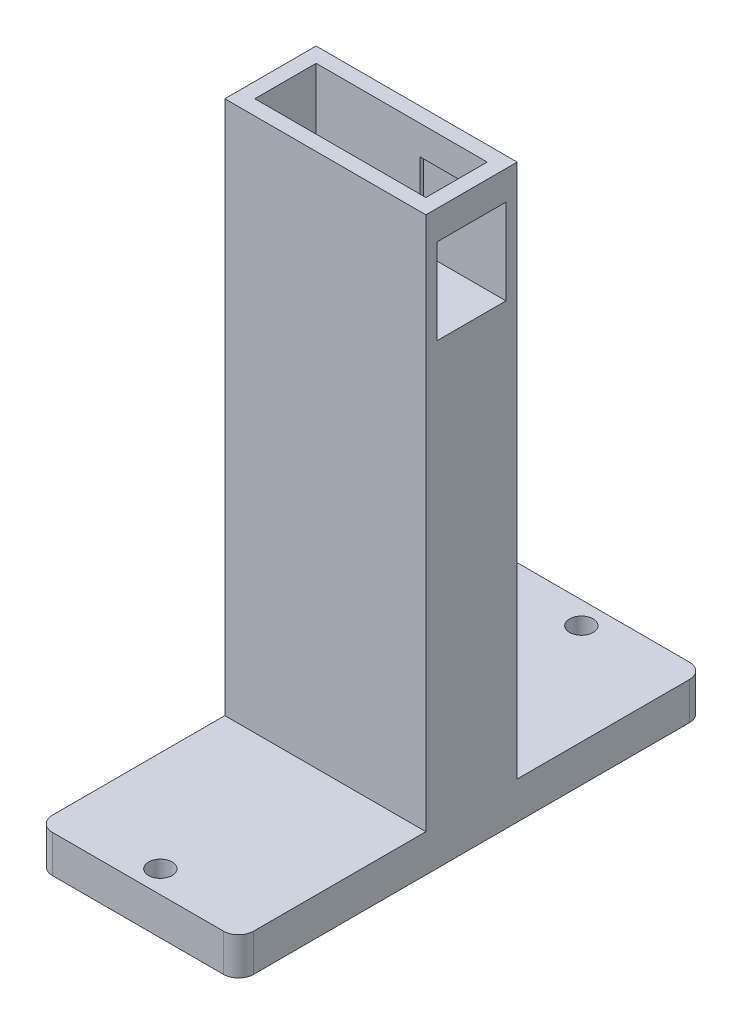
from build123d import *

# Parameters (mm, degrees)
SKETCH1_R             = 1.999996
BOSS_EXTRUDE1_DEPTH   = 6.35
BOSS_EXTRUDE1_2_DEPTH = 6.35
SKETCH1_3_W           = 34.08
SKETCH1_3_H           = 15.48
BOSS_EXTRUDE2_DEPTH   = 77.5
SKETCH2_W             = 34.08
SKETCH2_H             = 15.48
SKETCH2_W_2           = 29
SKETCH2_H_2           = 10.4
BOSS_EXTRUDE3_DEPTH   = 19.4
SKETCH3_W             = 11.67
SKETCH3_H             = 14.5
CUT_EXTRUDE1_DEPTH    = 13.97
SKETCH4_W             = 5
SKETCH4_H             = 10.4
BOSS_EXTRUDE4_DEPTH   = 3.2


with BuildPart() as part:
    # Sketch1 → Boss-Extrude1 (new body)
    with BuildSketch(Plane(origin=(0, 0, 0), x_dir=(1, 0, 0), z_dir=(0, 1, 0))):
        with BuildLine():
            Line((-17.04, 7.74), (17.04, 7.74))
            Line((17.04, 7.74), (17.04, 36.95))
            ThreePointArc((17.04, 36.95), (16.296051224, 38.746051224), (14.5, 39.49))
            Line((14.5, 39.49), (-14.5, 39.49))
            ThreePointArc((-14.5, 39.49), (-16.296051224, 38.746051224), (-17.04, 36.95))
            Line((-17.04, 36.95), (-17.04, 7.74))
        make_face()
        with Locations((-0.022, 35.68)):
            Circle(SKETCH1_R, mode=Mode.SUBTRACT)
    extrude(amount=BOSS_EXTRUDE1_DEPTH)



with BuildPart() as body_2:
    # Sketch1 → Boss-Extrude1 2 (new body)
    with BuildSketch(Plane(origin=(0, 0, 0), x_dir=(1, 0, 0), z_dir=(0, 1, 0))):
        with BuildLine():
            Line((17.04, -36.95), (17.04, -7.74))
            Line((17.04, -7.74), (-17.04, -7.74))
            Line((-17.04, -7.74), (-17.04, -36.95))
            ThreePointArc((-17.04, -36.95), (-16.296051224, -38.746051224), (-14.5, -39.49))
            Line((-14.5, -39.49), (14.5, -39.49))
            ThreePointArc((14.5, -39.49), (16.296051224, -38.746051224), (17.04, -36.95))
        make_face()
        with Locations((-0.022, -35.68)):
            Circle(SKETCH1_R, mode=Mode.SUBTRACT)
    extrude(amount=BOSS_EXTRUDE1_2_DEPTH)


with BuildPart() as part_1:
    add(part.part)

    add(body_2.part)  # Boss-Extrude2 merges body 2
    # Sketch1<3> → Boss-Extrude2 (add)
    with BuildSketch(Plane(origin=(0, 0, 0), x_dir=(1, 0, 0), z_dir=(0, 1, 0))):
        Rectangle(SKETCH1_3_W, SKETCH1_3_H)
    extrude(amount=BOSS_EXTRUDE2_DEPTH)

    # Sketch2 → Boss-Extrude3 (add)
    with BuildSketch(Plane(origin=(0, 77.5, 0), x_dir=(1, 0, 0), z_dir=(0, 1, 0))):
        Rectangle(SKETCH2_W, SKETCH2_H)
        Rectangle(SKETCH2_W_2, SKETCH2_H_2, mode=Mode.SUBTRACT)
    extrude(amount=BOSS_EXTRUDE3_DEPTH)

    # Sketch3 → Cut-Extrude1 (cut)
    with BuildSketch(Plane(origin=(17.04, 0, 0), x_dir=(0, 0, -1), z_dir=(1, 0, 0))):
        with Locations((0, 84.728)):
            Rectangle(SKETCH3_W, SKETCH3_H)
    extrude(amount=-CUT_EXTRUDE1_DEPTH, mode=Mode.SUBTRACT)

    # Sketch4 → Boss-Extrude4 (add)
    with BuildSketch(Plane(origin=(0, 77.5, 0), x_dir=(1, 0, 0), z_dir=(0, 1, 0))):
        with Locations((-12, 0)):
            Rectangle(SKETCH4_W, SKETCH4_H)
    extrude(amount=BOSS_EXTRUDE4_DEPTH)


solid = part_1.part
